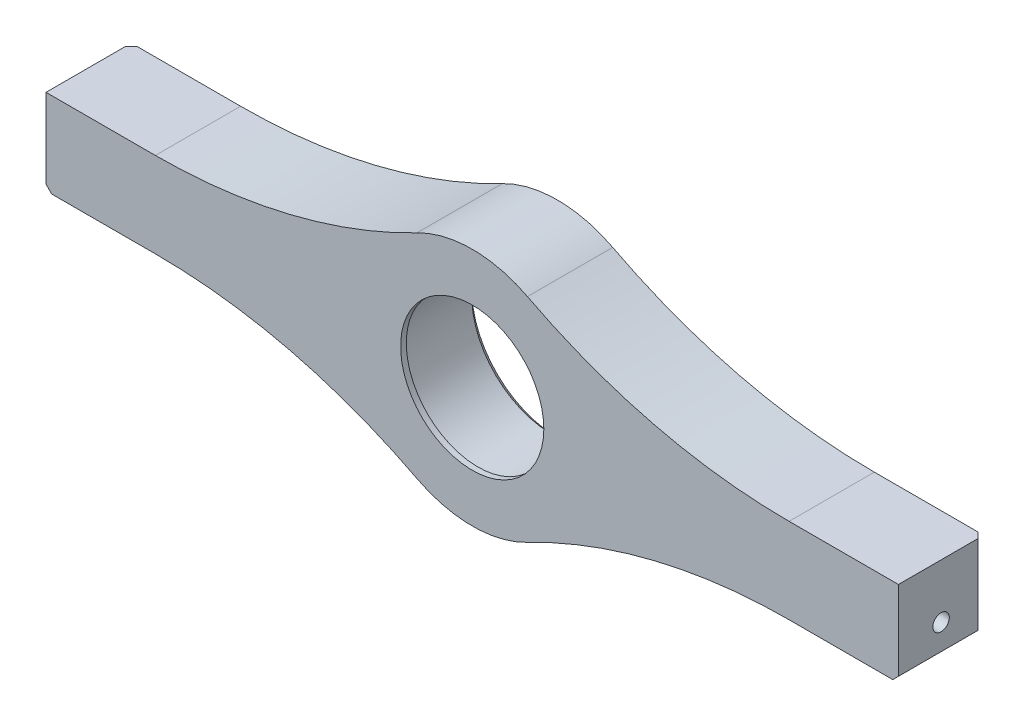
from build123d import *

# Parameters (mm, degrees)
SKIZZE1_R                       = 14.1
AUFSATZ_LINEAR_AUSTRAGEN1_DEPTH = 15
VERRUNDUNG1_R                   = 100
SKIZZE2_R                       = 1.4
SCHNITT_LINEAR_AUSTRAGEN1_DEPTH = 10
SKIZZE3_R                       = 1.45
SCHNITT_LINEAR_AUSTRAGEN2_DEPTH = 10
AUFSATZ_LINEAR_START            = -1
SKIZZE6_R                       = 14.1
SKIZZE6_R_2                     = 12.6
AUFSATZ_LINEAR_AUSTRAGEN3_DEPTH = 1
FASE1_SIZE                      = 1
FASE2_SIZE                      = 1


with BuildPart() as part:
    # Skizze1 → Aufsatz-Linear austragen1 (new body)
    with BuildSketch(Plane.XY):
        with BuildLine():
            Line((19.722068857, 7.5), (75, 7.5))
            Line((75, 7.5), (75, -7.5))
            Line((75, -7.5), (19.722068857, -7.5))
            ThreePointArc((19.722068857, -7.5), (0, -21.1), (-19.722068857, -7.5))
            Line((-19.722068857, -7.5), (-75, -7.5))
            Line((-75, -7.5), (-75, 7.5))
            Line((-75, 7.5), (-19.722068857, 7.5))
            ThreePointArc((-19.722068857, 7.5), (0, 21.1), (19.722068857, 7.5))
        make_face()
        Circle(SKIZZE1_R, mode=Mode.SUBTRACT)
    extrude(amount=AUFSATZ_LINEAR_AUSTRAGEN1_DEPTH)

    # Verrundung1
    verrundung1_edges = [part.edges().sort_by_distance(p)[0] for p in [
        (19.722068857, -7.5, 7.5),
        (-19.722068857, -7.5, 7.5),
        (-19.722068857, 7.5, 7.5),
        (19.722068857, 7.5, 7.5),
    ]]
    fillet(verrundung1_edges, radius=VERRUNDUNG1_R)

    # Skizze2 → Schnitt-Linear austragen1 (cut)
    with BuildSketch(Plane(origin=(0, 0, 0), x_dir=(-1, 0, 0), z_dir=(0, 0, -1))):
        with Locations((-67.5, 2)):
            Circle(SKIZZE2_R)
        with Locations((67.5, 2)):
            Circle(SKIZZE2_R)
    extrude(amount=-SCHNITT_LINEAR_AUSTRAGEN1_DEPTH, mode=Mode.SUBTRACT)

    # Skizze3 → Schnitt-Linear austragen2 (cut)
    with BuildSketch(Plane(origin=(75, 0, 0), x_dir=(0, 0, -1), z_dir=(1, 0, 0))):
        with Locations((-7.5, -2)):
            Circle(SKIZZE3_R)
    schnitt_linear_austragen2 = extrude(amount=-SCHNITT_LINEAR_AUSTRAGEN2_DEPTH, mode=Mode.SUBTRACT)

    # Spiegeln1: Schnitt-Linear austragen2 across plane
    add(schnitt_linear_austragen2.mirror(Plane(origin=(0, 0, 0), x_dir=(0, 0, 1), z_dir=(1, 0, 0))), mode=Mode.SUBTRACT)

    # Skizze6 → Aufsatz-Linear austragen3 (add)
    with BuildSketch(Plane.XY.offset(15).offset(AUFSATZ_LINEAR_START)):
        Circle(SKIZZE6_R)
        Circle(SKIZZE6_R_2, mode=Mode.SUBTRACT)
    extrude(amount=AUFSATZ_LINEAR_AUSTRAGEN3_DEPTH)

    # Fase1
    fase1_edges = [part.edges().sort_by_distance(p)[0] for p in [
        (-14.1, 0, 0),
    ]]
    chamfer(fase1_edges, length=FASE1_SIZE)

    # Fase2
    fase2_edges = [part.edges().sort_by_distance(p)[0] for p in [
        (-75, -7.5, 7.5),
        (-75, 0, 0),
        (75, -7.5, 7.5),
        (75, 0, 0),
    ]]
    chamfer(fase2_edges, length=FASE2_SIZE)


solid = part.part
